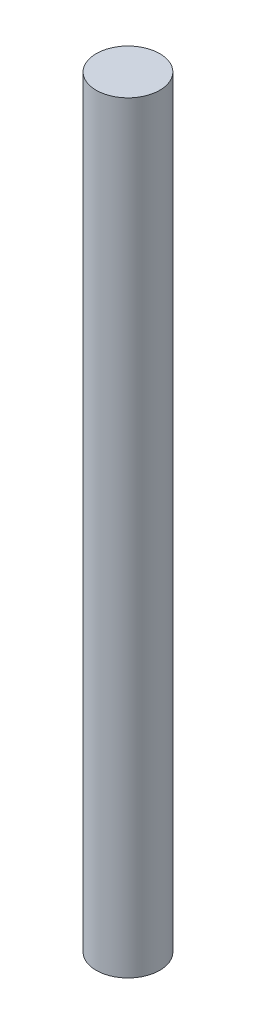
from build123d import *

# Parameters (mm, degrees)
BAR_FACE_R        = 2.5
BAR_EXTRUDE_DEPTH = 60


with BuildPart() as part:
    # Bar face → Bar extrude (new body)
    with BuildSketch(Plane(origin=(0, 0, 0), x_dir=(1, 0, 0), z_dir=(0, 1, 0))):
        Circle(BAR_FACE_R)
    extrude(amount=BAR_EXTRUDE_DEPTH)


solid = part.part
